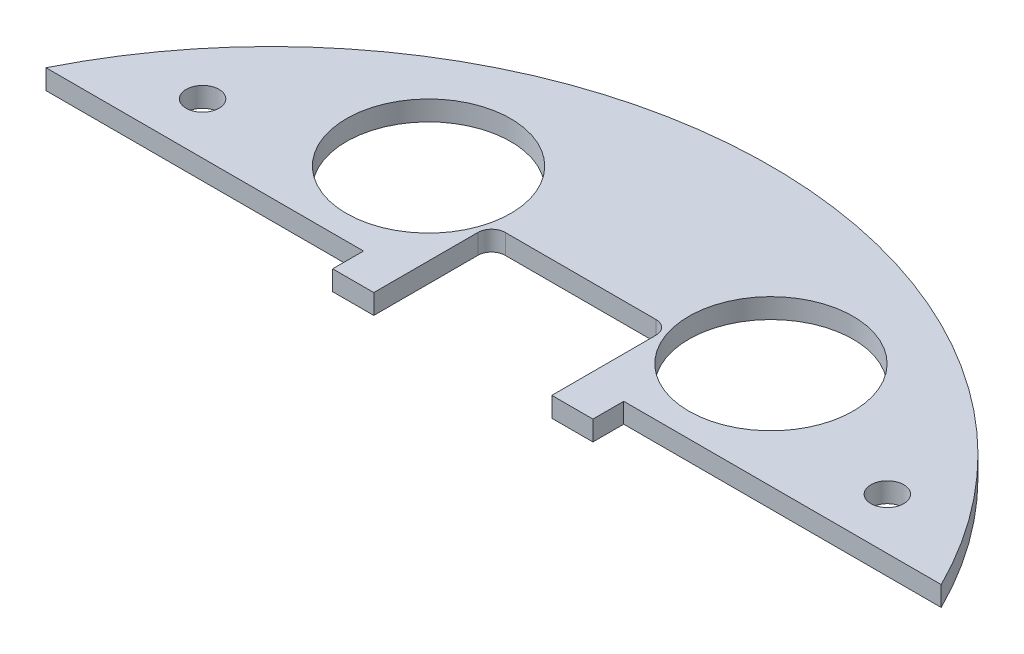
from build123d import *

# Parameters (mm, degrees)
BOSS_EXTRUDE1_DEPTH  = 2.9
SOLENOID_PLACEMENT_W = 38
SOLENOID_PLACEMENT_H = 64
CUT_EXTRUDE1_DEPTH   = 104.278313309
CUT_EXTRUDE4_DEPTH   = 104.278313309
SKETCH5_R            = 12
CUT_EXTRUDE5_DEPTH   = 104.278313309
SKETCH6_R            = 2.4
CUT_EXTRUDE6_DEPTH   = 104.278313309
SKETCH7_W            = 10
SKETCH7_H            = 62.80248699
CUT_EXTRUDE7_DEPTH   = 104.278313309
CUT_EXTRUDE3_DEPTH   = 104.278313309


with BuildPart() as part:
    # Sketch1 → Boss-Extrude1 (new body)
    with BuildSketch(Plane(origin=(0, 0, 0), x_dir=(1, 0, 0), z_dir=(0, 1, 0))):
        with BuildLine():
            ThreePointArc((36.856602833, -63.012624351), (0, 73), (-36.856602833, -63.012624351))
            ThreePointArc((-36.856602833, -63.012624351), (-33.368752207, -63.602994345), (-30.363140064, -61.737536127))
            ThreePointArc((-30.363140064, -61.737536127), (0, -46.75), (30.363140064, -61.737536127))
            ThreePointArc((30.363140064, -61.737536127), (33.368752207, -63.602994345), (36.856602833, -63.012624351))
        make_face()
    extrude(amount=BOSS_EXTRUDE1_DEPTH)

    # solenoid placement → Cut-Extrude1 (cut, through all)
    with BuildSketch(Plane(origin=(0, 2.9, 0), x_dir=(1, 0, 0), z_dir=(0, 1, 0))):
        with Locations((0, -4)):
            Rectangle(SOLENOID_PLACEMENT_W, SOLENOID_PLACEMENT_H)
    extrude(amount=-CUT_EXTRUDE1_DEPTH, mode=Mode.SUBTRACT)

    # Sketch4 → Cut-Extrude4 (cut, through all)
    with BuildSketch(Plane(origin=(0, 2.9, 0), x_dir=(1, 0, 0), z_dir=(0, 1, 0))):
        with BuildLine():
            Line((-13, 28), (13, 28))
            Line((13, 28), (13, 43.2))
            ThreePointArc((13, 43.2), (12.414213562, 44.614213562), (11, 45.2))
            Line((11, 45.2), (-11, 45.2))
            ThreePointArc((-11, 45.2), (-12.414213562, 44.614213562), (-13, 43.2))
            Line((-13, 43.2), (-13, 28))
        make_face()
    extrude(amount=-CUT_EXTRUDE4_DEPTH, mode=Mode.SUBTRACT)

    # Sketch5 → Cut-Extrude5 (cut, through all)
    with BuildSketch(Plane(origin=(0, 2.9, 0), x_dir=(1, 0, 0), z_dir=(0, 1, 0))):
        with Locations((25, 48)):
            Circle(SKETCH5_R)
        with Locations((-25, 48)):
            Circle(SKETCH5_R)
    extrude(amount=-CUT_EXTRUDE5_DEPTH, mode=Mode.SUBTRACT)

    # Sketch6 → Cut-Extrude6 (cut, through all)
    with BuildSketch(Plane(origin=(0, 2.9, 0), x_dir=(1, 0, 0), z_dir=(0, 1, 0))):
        with Locations((40, -40)):
            Circle(SKETCH6_R)
        with Locations((-40, -40)):
            Circle(SKETCH6_R)
        with Locations((-50, 40)):
            Circle(SKETCH6_R)
        with Locations((50, 40)):
            Circle(SKETCH6_R)
    extrude(amount=-CUT_EXTRUDE6_DEPTH, mode=Mode.SUBTRACT)

    # Sketch7 → Cut-Extrude7 (cut, through all)
    with BuildSketch(Plane(origin=(0, 2.9, 0), x_dir=(1, 0, 0), z_dir=(0, 1, 0))):
        with Locations((0, -31.401243495)):
            Rectangle(SKETCH7_W, SKETCH7_H)
    extrude(amount=-CUT_EXTRUDE7_DEPTH, mode=Mode.SUBTRACT)

    # Sketch3 → Cut-Extrude3 (cut, through all)
    with BuildSketch(Plane(origin=(0, 2.9, 0), x_dir=(1, 0, 0), z_dir=(0, 1, 0))):
        Polygon((-19, 28), (19, 28), (19, 32.5), (73, 32.5), (73, -32.5), (-73, -32.5), (-73, 32.5), (-19, 32.5), align=None)
    extrude(amount=-CUT_EXTRUDE3_DEPTH, mode=Mode.SUBTRACT)


with BuildPart() as cut_extrude3_piece_1:
    # of the separate pieces the step leaves, piece 1, a body of its own (cut_extrude3_pieces)
    add(part.part.solids().sort_by_distance((19, 0, -32.5))[0])


with BuildPart() as cut_extrude3_piece_2:
    # of the separate pieces the step leaves, piece 2, a body of its own (cut_extrude3_pieces)
    add(part.part.solids().sort_by_distance((30.363140064, 0, 61.737536127))[0])


with BuildPart() as cut_extrude3_piece_3:
    # of the separate pieces the step leaves, piece 3, a body of its own (cut_extrude3_pieces)
    add(part.part.solids().sort_by_distance((-36.856602833, 0, 63.012624351))[0])


solid = cut_extrude3_piece_1.part
